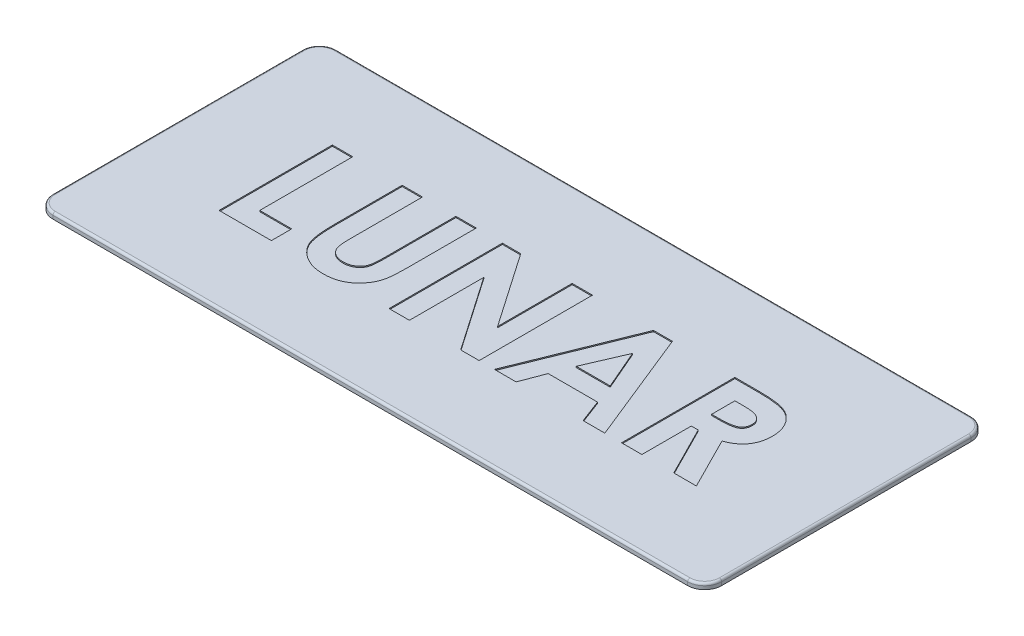
from build123d import *

# Parameters (mm, degrees)
SKETCH1_W           = 295
SKETCH1_H           = 125
BOSS_EXTRUDE1_DEPTH = 2.5
FILLET1_R           = 7.5
FILLET2_R           = 1
CUT_EXTRUDE3_DEPTH  = 0.5


with BuildPart() as part:
    # Sketch1 → Boss-Extrude1 (new body)
    with BuildSketch(Plane(origin=(0, 0, 0), x_dir=(1, 0, 0), z_dir=(0, 1, 0))):
        Rectangle(SKETCH1_W, SKETCH1_H)
    extrude(amount=BOSS_EXTRUDE1_DEPTH)

    # Fillet1
    fillet1_edges = [part.edges().sort_by_distance(p)[0] for p in [
        (147.5, 1.25, 62.5),
        (-147.5, 1.25, 62.5),
        (147.5, 1.25, -62.5),
        (-147.5, 1.25, -62.5),
    ]]
    fillet(fillet1_edges, radius=FILLET1_R)

    # Fillet2
    fillet2_edges = [part.edges().sort_by_distance(p)[0] for p in [
        (145.303300859, 2.5, -60.303300859),
        (147.5, 2.5, 0),
        (145.303300859, 2.5, 60.303300859),
        (0, 2.5, 62.5),
        (-145.303300859, 2.5, 60.303300859),
        (-147.5, 2.5, 0),
        (-145.303300859, 2.5, -60.303300859),
        (0, 2.5, -62.5),
    ]]
    fillet(fillet2_edges, radius=FILLET2_R)

    # Sketch3 → Cut-Extrude3 (cut)
    # profile 1 of 5: a face of its own
    with BuildSketch(Plane(origin=(0, 2.5, 0), x_dir=(1, 0, 0), z_dir=(0, 1, 0))):
        Polygon((-104.230769231, 25), (-95.256410256, 25), (-95.256410256, -16.025641026), (-81.153846154, -16.025641026), (-81.153846154, -25), (-104.230769231, -25), align=None)
    # profile 2 of 5: a face of its own
    with BuildSketch(Plane(origin=(0, 2.5, 0), x_dir=(1, 0, 0), z_dir=(0, 1, 0))):
        with BuildLine():
            Line((-73.461538462, 25), (-64.487179487, 25))
            Line((-64.487179487, 25), (-64.487179487, -7.532051282))
            add(Edge.make_bspline(
                [(-64.487179487, -7.532051282), (-64.486691506, -7.869329479), (-64.485748975, -8.520778833), (-64.438565382, -9.455395369), (-64.395389141, -10.314503653), (-64.317486947, -11.097163146), (-64.202398705, -11.803708642), (-64.090955734, -12.438678737), (-63.940128692, -12.99070501), (-63.713459761, -13.619055433), (-63.364237348, -14.325041454), (-62.793627301, -15.060836281), (-62.135192122, -15.732355857), (-61.346019635, -16.291303309), (-60.459059552, -16.743441418), (-59.479185323, -17.07842572), (-58.407778224, -17.264632514), (-57.666958986, -17.293060392), (-57.285657051, -17.307692308)],
                knots=[0, 0, 0, 0, 1.155499968, 2.231836252, 3.205919964, 4.102923608, 4.924856345, 5.658536265, 6.31071849, 6.882491295, 7.94666036, 8.992281882, 10.060072772, 11.158554251, 12.289267114, 13.461410017, 14.693379945, 16, 16, 16, 16], degree=3))
            add(Edge.make_bspline(
                [(-57.285657051, -17.307692308), (-56.8805708, -17.295871598), (-56.090721193, -17.272823215), (-54.954648275, -17.046578387), (-53.902070273, -16.686319137), (-52.955273854, -16.172137374), (-52.115201233, -15.555800417), (-51.404097362, -14.852983146), (-50.842896799, -14.062283789), (-50.477127152, -13.33280342), (-50.271765507, -12.661380266), (-50.117836725, -12.061489155), (-50.004989898, -11.353677025), (-49.902611548, -10.54899789), (-49.841090047, -9.63911682), (-49.774380008, -8.6313512), (-49.74993016, -7.518805626), (-49.745762861, -6.744119263), (-49.743589744, -6.340144231)],
                knots=[0, 0, 0, 0, 1.261321664, 2.459363699, 3.594844139, 4.716940403, 5.803436589, 6.833651888, 7.818396249, 8.814403945, 9.360733334, 10.004355033, 10.743453831, 11.592799886, 12.532235708, 13.585170094, 14.740740724, 16, 16, 16, 16], degree=3))
            Line((-49.743589744, -6.340144231), (-49.743589744, 25))
            Line((-49.743589744, 25), (-40.769230769, 25))
            Line((-40.769230769, 25), (-40.769230769, -4.827724359))
            add(Edge.make_bspline(
                [(-40.769230769, -4.827724359), (-40.770477022, -5.432032629), (-40.772873445, -6.594058496), (-40.809675273, -8.263971441), (-40.888019708, -9.789169051), (-40.953819997, -11.170096983), (-41.081166089, -12.404894901), (-41.213830843, -13.498835742), (-41.382923486, -14.44804283), (-41.63452317, -15.528599746), (-42.068709741, -16.772821461), (-42.768675416, -18.20548883), (-43.657236535, -19.608156965), (-44.707471372, -20.965395549), (-45.893282571, -22.226226454), (-47.188378159, -23.333072789), (-48.572182287, -24.269345433), (-50.059154717, -25.012151393), (-51.648029958, -25.591484043), (-53.354528745, -25.980766404), (-55.177487381, -26.243770454), (-56.436639367, -26.26903523), (-57.085336538, -26.282051282)],
                knots=[0, 0, 0, 0, 1.170808336, 2.251350247, 3.235597562, 4.129743112, 4.929140599, 5.639994148, 6.264258765, 6.79612947, 7.788252245, 8.809469599, 9.879094798, 10.999557536, 12.129761673, 13.226370002, 14.293821979, 15.358369427, 16.438775801, 17.562147481, 18.744053101, 20, 20, 20, 20], degree=3))
            add(Edge.make_bspline(
                [(-57.085336538, -26.282051282), (-57.516343844, -26.274791533), (-58.366712416, -26.260468198), (-59.617328582, -26.134173793), (-60.826294775, -25.948063328), (-61.991339356, -25.676547326), (-63.116505977, -25.325799364), (-64.201495708, -24.894053049), (-65.242276465, -24.383716608), (-66.233024185, -23.799484032), (-67.172519667, -23.167737074), (-68.031170042, -22.467418977), (-68.838523485, -21.750320909), (-69.571255892, -20.986264341), (-70.234870735, -20.183270561), (-70.828001298, -19.339519725), (-71.349766387, -18.455086775), (-71.813290718, -17.514029862), (-72.210022304, -16.468518459), (-72.544481936, -15.281363295), (-72.83667374, -13.933956898), (-73.053813449, -12.423263633), (-73.250673584, -10.754262578), (-73.375275195, -8.922605728), (-73.440459907, -6.928240534), (-73.454334738, -5.54558849), (-73.461538462, -4.827724359)],
                knots=[0, 0, 0, 0, 1.001158378, 1.975264943, 2.917723546, 3.841610987, 4.75185031, 5.653588123, 6.552117133, 7.442167995, 8.324307438, 9.179605724, 10.014504199, 10.831958861, 11.636465792, 12.43274043, 13.225645099, 14.020104002, 14.867201867, 15.819789774, 16.883317127, 18.068162734, 19.364263498, 20.787406516, 22.332041935, 24, 24, 24, 24], degree=3))
            Line((-73.461538462, -4.827724359), (-73.461538462, 25))
        make_face()
    # profile 3 of 5: a face of its own
    with BuildSketch(Plane(origin=(0, 2.5, 0), x_dir=(1, 0, 0), z_dir=(0, 1, 0))):
        Polygon((-29.230769231, 25), (-21.147836538, 25), (1.538461538, -7.902644231), (1.538461538, 25), (10.512820513, 25), (10.512820513, -25), (2.369791667, -25), (-20.256410256, 7.802483974), (-20.256410256, -25), (-29.230769231, -25), align=None)
    # profile 4 of 5: a face of its own
    with BuildSketch(Plane(origin=(0, 2.5, 0), x_dir=(1, 0, 0), z_dir=(0, 1, 0))):
        Polygon((37.445913462, 25), (45.769230769, 25), (65.961538462, -25), (56.376201923, -25), (52.489983974, -14.743589744), (30.705128205, -14.743589744), (26.818910256, -25), (17.243589744, -25), align=None)
        Polygon((41.602564103, 11.588541667), (34.110576923, -5.769230769), (49.094551282, -5.769230769), align=None, mode=Mode.SUBTRACT)
    # profile 5 of 5: a face of its own
    with BuildSketch(Plane(origin=(0, 2.5, 0), x_dir=(1, 0, 0), z_dir=(0, 1, 0))):
        with BuildLine():
            Line((73.333333333, 25), (83.790064103, 25))
            add(Edge.make_bspline(
                [(83.790064103, 25), (84.481250823, 24.997546684), (85.810597585, 24.992828266), (87.727443007, 24.918384127), (89.488329136, 24.814788998), (91.095863124, 24.656700081), (92.549357241, 24.447093287), (93.850268228, 24.200001562), (94.99855806, 23.918387566), (96.003910977, 23.567474309), (96.91119227, 23.171649475), (97.756904572, 22.716839483), (98.559705553, 22.208108785), (99.314229356, 21.6320713), (100.02703297, 20.999089801), (100.699461142, 20.30852713), (101.322011838, 19.554527598), (101.8908302, 18.741855528), (102.409262349, 17.886943145), (102.867447636, 16.98861665), (103.240044672, 16.046251317), (103.569274095, 15.073466362), (103.806407383, 14.056355632), (103.971330116, 13.004820874), (104.092080089, 11.915160572), (104.099022635, 11.174893743), (104.102564103, 10.797275641)],
                knots=[0, 0, 0, 0, 1.749336639, 3.364467119, 4.854658419, 6.213483162, 7.451590619, 8.570285859, 9.5643256, 10.440900261, 11.26203566, 12.067320669, 12.869050712, 13.665104639, 14.467235401, 15.27997916, 16.102287765, 16.939272006, 17.78853747, 18.631303466, 19.488103222, 20.351255419, 21.228522269, 22.127379805, 23.044756219, 24, 24, 24, 24], degree=3))
            add(Edge.make_bspline(
                [(104.102564103, 10.797275641), (104.093364643, 10.40312909), (104.075326179, 9.630279539), (103.9781612, 8.495026583), (103.800574141, 7.408895962), (103.531592704, 6.375067733), (103.22243348, 5.380674699), (102.811331016, 4.444064032), (102.347361253, 3.551614088), (101.796317922, 2.715948909), (101.191574786, 1.918506703), (100.488271241, 1.189840437), (99.731970551, 0.490787061), (98.880158303, -0.134867096), (97.97038317, -0.729426505), (96.984568879, -1.268255667), (95.92914919, -1.764899506), (95.187136881, -2.041862417), (94.807692308, -2.18349359)],
                knots=[0, 0, 0, 0, 1.099860209, 2.156625411, 3.176576793, 4.16617041, 5.135385252, 6.078461593, 7.016046972, 7.938469504, 8.868247731, 9.803980173, 10.76021508, 11.73834243, 12.748633912, 13.790971185, 14.870363756, 16, 16, 16, 16], degree=3))
            Line((94.807692308, -2.18349359), (106.346153846, -25))
            Line((106.346153846, -25), (96.370192308, -25))
            Line((96.370192308, -25), (85.352564103, -3.205128205))
            Line((85.352564103, -3.205128205), (82.307692308, -3.205128205))
            Line((82.307692308, -3.205128205), (82.307692308, -25))
            Line((82.307692308, -25), (73.333333333, -25))
            Line((73.333333333, -25), (73.333333333, 25))
        make_face()
        with BuildLine():
            Line((82.307692308, 5.769230769), (85.803285256, 5.769230769))
            add(Edge.make_bspline(
                [(85.803285256, 5.769230769), (86.230650552, 5.774044044), (87.048963262, 5.783260432), (88.225804419, 5.826009859), (89.29465685, 5.929014853), (90.26011057, 6.059157813), (91.127023654, 6.209426655), (91.887663542, 6.42477103), (92.553750536, 6.655517978), (93.117391478, 6.942276579), (93.598953347, 7.268383303), (94.0147512, 7.638848648), (94.358675642, 8.067615113), (94.641743, 8.543030675), (94.861938629, 9.069300266), (95.02266457, 9.640646641), (95.112486602, 10.263578168), (95.122820933, 10.693485742), (95.128205128, 10.917467949)],
                knots=[0, 0, 0, 0, 1.688639943, 3.233382647, 4.650958383, 5.928841754, 7.082724185, 8.122798841, 9.049171256, 9.863274652, 10.613301712, 11.341792392, 12.054588806, 12.776240173, 13.521029143, 14.301969904, 15.115324896, 16, 16, 16, 16], degree=3))
            add(Edge.make_bspline(
                [(95.128205128, 10.917467949), (95.118025814, 11.182455251), (95.098030438, 11.7029737), (94.899614189, 12.452337752), (94.583778379, 13.145925451), (94.150853989, 13.780602999), (93.605642004, 14.33700515), (92.979968236, 14.827478077), (92.260329133, 15.215307369), (91.593997478, 15.47111544), (90.987791421, 15.624168048), (90.440709581, 15.738221498), (89.807185515, 15.819054452), (89.086740949, 15.904792187), (88.28121232, 15.960388769), (87.386209015, 16.000963192), (86.404301477, 16.017564182), (85.719818666, 16.022871225), (85.362580128, 16.025641026)],
                knots=[0, 0, 0, 0, 1.020303359, 2.004196876, 2.966617323, 3.9489082, 4.950758222, 5.960522915, 7.003732012, 8.091992268, 8.70421221, 9.413913587, 10.24622431, 11.166358409, 12.212345909, 13.359657661, 14.621978493, 16, 16, 16, 16], degree=3))
            Line((85.362580128, 16.025641026), (82.307692308, 16.025641026))
            Line((82.307692308, 16.025641026), (82.307692308, 5.769230769))
        make_face(mode=Mode.SUBTRACT)
    extrude(amount=-CUT_EXTRUDE3_DEPTH, mode=Mode.SUBTRACT)


solid = part.part
